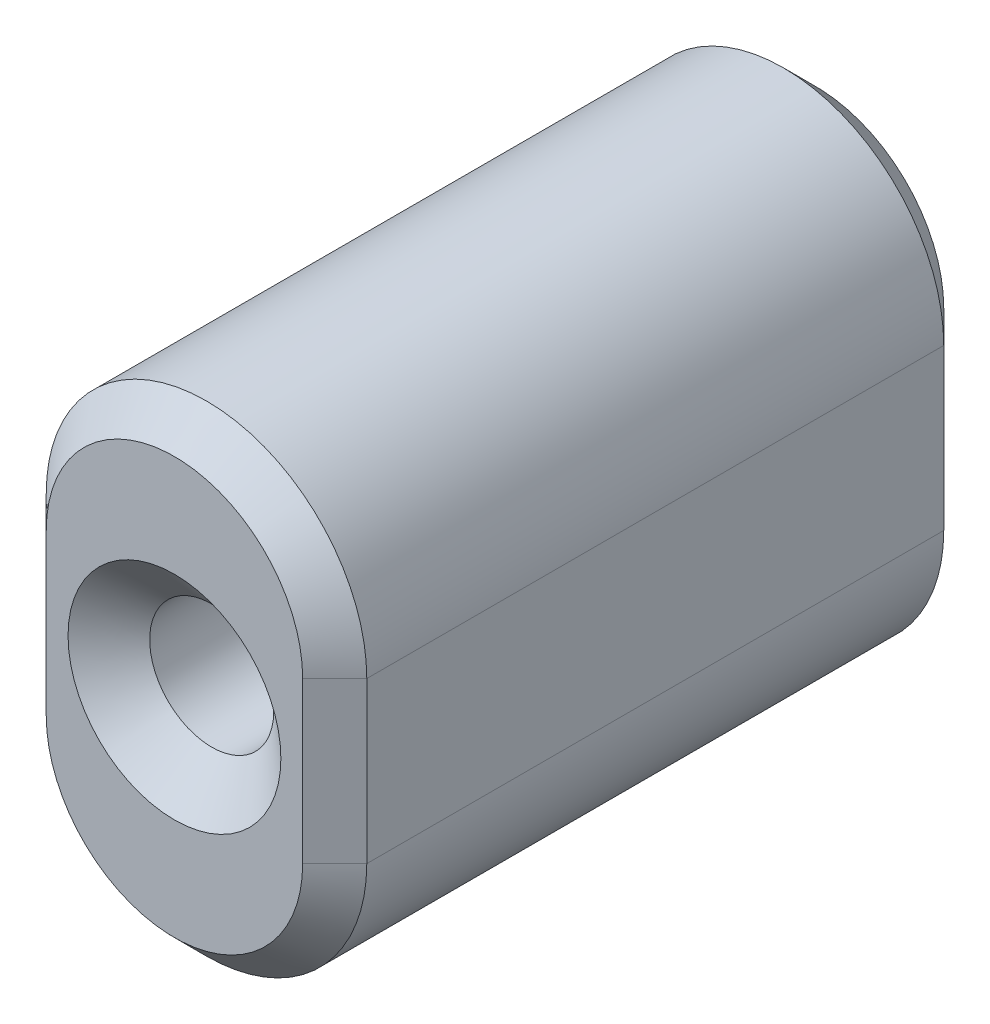
from build123d import *

# Parameters (mm, degrees)
BOSS_EXTRUDE1_DEPTH                               = 25.4
CHAMFER1_SIZE                                     = 1.27
CSK_FOR_8_FLAT_HEAD_MACHINE_SCREW_100_D           = 4.9149
CSK_FOR_8_FLAT_HEAD_MACHINE_SCREW_100_CSINK_D     = 8.4328
CSK_FOR_8_FLAT_HEAD_MACHINE_SCREW_100_CSINK_ANGLE = 100


with BuildPart() as part:
    # Sketch1 → Boss-Extrude1 (new body)
    with BuildSketch(Plane.XY):
        with BuildLine():
            Line((-6.35, -3.175), (-6.35, 3.175))
            ThreePointArc((-6.35, 3.175), (0, 9.525), (6.35, 3.175))
            Line((6.35, 3.175), (6.35, -3.175))
            ThreePointArc((6.35, -3.175), (0, -9.525), (-6.35, -3.175))
        make_face()
    extrude(amount=BOSS_EXTRUDE1_DEPTH)

    # Chamfer1
    chamfer1_edges = [part.edges().sort_by_distance(p)[0] for p in [
        (6.35, 0, 0),
        (0, 9.525, 0),
        (-6.35, 0, 0),
        (0, -9.525, 0),
        (-6.35, 0, 25.4),
        (0, 9.525, 25.4),
        (6.35, 0, 25.4),
        (0, -9.525, 25.4),
    ]]
    chamfer(chamfer1_edges, length=CHAMFER1_SIZE)

    # CSK for #8 Flat Head Machine Screw (100)1 (through all)
    with Locations(Plane.XY.offset(25.4)):
        with Locations((0, 0)):
            CounterSinkHole(CSK_FOR_8_FLAT_HEAD_MACHINE_SCREW_100_D / 2, CSK_FOR_8_FLAT_HEAD_MACHINE_SCREW_100_CSINK_D / 2, counter_sink_angle=CSK_FOR_8_FLAT_HEAD_MACHINE_SCREW_100_CSINK_ANGLE)


solid = part.part
